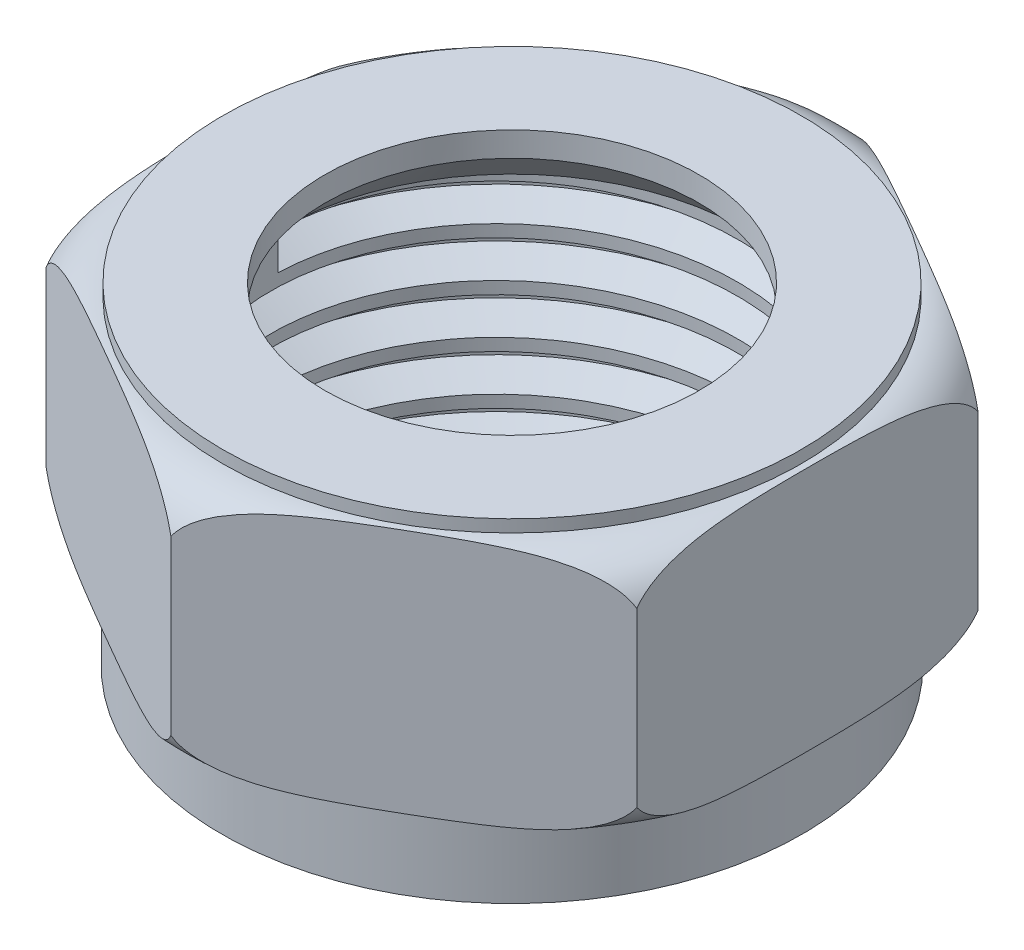
from build123d import *

# Parameters (mm, degrees)
BOSS_EXTRUDE1_DEPTH = 6.75
SKETCH2_R           = 11.75
CUT_EXTRUDE1_DEPTH  = 0.5
SKETCH3_R           = 11.8
CUT_EXTRUDE2_DEPTH  = 3
THREAD1_PITCH       = 2


with BuildPart() as part:
    # Sketch1 → Boss-Extrude1 (new, symmetric)
    with BuildSketch(Plane(origin=(0, 0, 0), x_dir=(1, 0, 0), z_dir=(0, 1, 0))):
        Polygon((12, 6.92820323), (0, 13.856406461), (-12, 6.92820323), (-12, -6.92820323), (0, -13.856406461), (12, -6.92820323), align=None)
    extrude(amount=BOSS_EXTRUDE1_DEPTH, both=True)

    # Sketch2 → Cut-Extrude1 (cut)
    with BuildSketch(Plane(origin=(0, 6.75, 0), x_dir=(1, 0, 0), z_dir=(0, 1, 0))):
        Polygon((12, -6.92820323), (12, 6.92820323), (0, 13.856406461), (-12, 6.92820323), (-12, -6.92820323), (0, -13.856406461), align=None)
        with Locations(Location((0, 0, 0), (0, 0, 270))):
            Circle(SKETCH2_R, mode=Mode.SUBTRACT)
    extrude(amount=-CUT_EXTRUDE1_DEPTH, mode=Mode.SUBTRACT)

    # Sketch3 → Cut-Extrude2 (cut)
    with BuildSketch(Plane.XZ.offset(6.75)):
        Polygon((12, -6.92820323), (12, 6.92820323), (0, 13.856406461), (-12, 6.92820323), (-12, -6.92820323), (0, -13.856406461), align=None)
        with Locations(Location((0, 0, 0), (0, 0, 270))):
            Circle(SKETCH3_R, mode=Mode.SUBTRACT)
    extrude(amount=-CUT_EXTRUDE2_DEPTH, mode=Mode.SUBTRACT)

    # Sketch8 → Cut-Revolve2 (revolve, cut)
    with BuildSketch(Plane(origin=(0, 0, 0), x_dir=(0, 0, -1), z_dir=(1, 0, 0))):
        with BuildLine():
            Line((-11.75, 6.25), (-13.856406461, 6.25))
            Line((-13.856406461, 6.25), (-13.856406461, 4.75))
            ThreePointArc((-13.856406461, 4.75), (-13.042956706, 5.836678847), (-11.75, 6.25))
        make_face()
    cut_revolve2 = revolve(axis=Axis((0, 6.75, 0), (0, -1, 0)), mode=Mode.SUBTRACT)

    # Mirror1: Cut-Revolve2 across plane
    add(cut_revolve2.mirror(Plane.ZX.offset(1.25)), mode=Mode.SUBTRACT)

    # Sketch5 → Cut-Revolve1 (revolve, cut)
    with BuildSketch(Plane(origin=(0, 0, 0), x_dir=(0, 0, -1), z_dir=(1, 0, 0))):
        Polygon((-7.6, 6.75), (-7.6, 5.75), (-9.5, 3.85), (-9.5, -6.75), (0, -6.75), (0, 6.75), align=None)
    revolve(axis=Axis((0, 6.75, 0), (0, -1, 0)), mode=Mode.SUBTRACT)

    # Thread1: the profile of Thread Profile1 profile screwed along a right-hand helix of 10 turns, 10 arcs to a turn; built about Z, then put on its axis
    thread1_z = Axis((0, 0, 0), (0, 0, 1))
    thread1_corners = [(9.4997, 0, -0.000173205), (10.58253175, 0, 0.624999997), (10.58253175, 0, 0.874999997), (9.4997, 0, 1.5001732)]
    with BuildLine(mode=Mode.PRIVATE) as thread1_profile:
        Line(thread1_corners[0], thread1_corners[1])
        Line(thread1_corners[1], thread1_corners[2])
        Line(thread1_corners[2], thread1_corners[3])
        Line(thread1_corners[3], thread1_corners[0])
    thread1_cap = Face(thread1_profile.wire())
    thread1_turn_angles = [0, 18, 36, 54, 72, 90, 108, 126, 144, 162, 180, 198, 216, 234, 252, 270, 288, 306, 324, 342, 360]
    thread1_turn_weights = [1, 0.9510565162951535, 1, 0.9510565162951535, 1, 0.9510565162951535, 1, 0.9510565162951535, 1, 0.9510565162951535, 1, 0.9510565162951535, 1, 0.9510565162951535, 1, 0.9510565162951535, 1, 0.9510565162951535, 1, 0.9510565162951535, 1]
    thread1_turn_rails = [Edge.make_bspline([Vector(p[0], p[1], 0).rotate(thread1_z, thread1_turn_angles[k]) / thread1_turn_weights[k] + Vector(0, 0, p[2] + THREAD1_PITCH * thread1_turn_angles[k] / 360) for k in range(21)], [0, 0, 0, 1, 1, 2, 2, 3, 3, 4, 4, 5, 5, 6, 6, 7, 7, 8, 8, 9, 9, 10, 10, 10], 2, thread1_turn_weights) for p in thread1_corners]
    thread1_turn_sides = [Face.make_surface_from_curves(thread1_turn_rails[p[0]], thread1_turn_rails[p[1]]) for p in [(0, 1), (1, 2), (2, 3), (3, 0)]]
    thread1 = Plane(origin=(0, 3.85, 0), x_dir=(-1, 0, 0), z_dir=(0, -1, 0)) * Solid(Shell([*[p.moved(Location((0, 0, THREAD1_PITCH * i))) for i in range(10) for p in thread1_turn_sides], thread1_cap, thread1_cap.rotate(thread1_z, 3600).moved(Location((0, 0, THREAD1_PITCH * 3600 / 360)))]))
    add(thread1, mode=Mode.SUBTRACT)


solid = part.part
